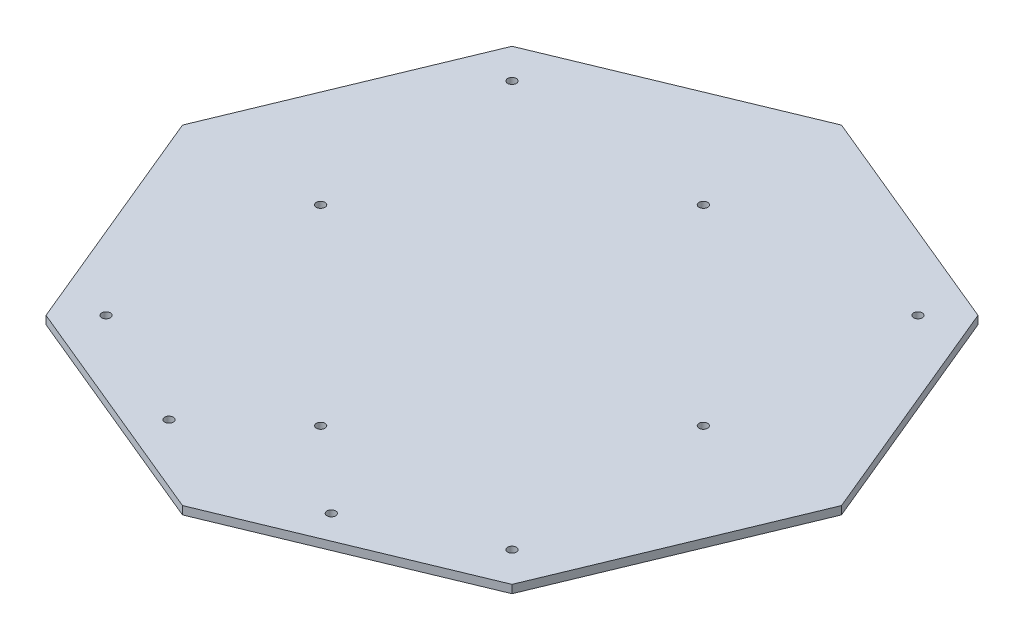
from build123d import *

# Parameters (mm, degrees)
BOSS_EXTRUDE2_DEPTH     = 3
CUT_EXTRUDE3_DEPTH      = 173.233673841
CUT_EXTRUDE3_DEPTH_BACK = 173.233673841
SKETCH3_R               = 1.6
CUT_EXTRUDE4_DEPTH      = 173.233673841
CUT_EXTRUDE4_DEPTH_BACK = 173.233673841
SKETCH4_R               = 1.6


with BuildPart() as part:
    # Sketch1 → Boss-Extrude2 (new body)
    with BuildSketch(Plane(origin=(0, 0, 0), x_dir=(1, 0, 0), z_dir=(0, 1, 0))):
        Polygon((0, -121.769122533), (86.103772282, -86.103772282), (121.769122533, 0), (86.103772282, 86.103772282), (0, 121.769122533), (-86.103772282, 86.103772282), (-121.769122533, 0), (-86.103772282, -86.103772282), align=None)
    extrude(amount=BOSS_EXTRUDE2_DEPTH)

    # Sketch3 → Cut-Extrude3 (cut, two sides: drawn at the far end of the back side and taken through both)
    with BuildSketch(Plane(origin=(0, 3, 0), x_dir=(1, 0, 0), z_dir=(0, 1, 0)).offset(-CUT_EXTRUDE3_DEPTH_BACK)):
        with Locations((-75, -75)):
            Circle(SKETCH3_R)
        with Locations((75, -75)):
            Circle(SKETCH3_R)
        with Locations((75, 75)):
            Circle(SKETCH3_R)
        with Locations((-75, 75)):
            Circle(SKETCH3_R)
        with Locations((-70.710678119, 0)):
            Circle(SKETCH3_R)
        with Locations((0, 70.710678119)):
            Circle(SKETCH3_R)
        with Locations((70.710678119, 0)):
            Circle(SKETCH3_R)
        with Locations((0, -70.710678119)):
            Circle(SKETCH3_R)
    extrude(amount=CUT_EXTRUDE3_DEPTH + CUT_EXTRUDE3_DEPTH_BACK, mode=Mode.SUBTRACT)

    # Sketch4 → Cut-Extrude4 (cut, two sides: drawn at the far end of the back side and taken through both)
    with BuildSketch(Plane(origin=(0, 3, 0), x_dir=(1, 0, 0), z_dir=(0, 1, 0)).offset(-CUT_EXTRUDE4_DEPTH_BACK)):
        with Locations((-30, -96.769122533)):
            Circle(SKETCH4_R)
        with Locations((30, -96.769122533)):
            Circle(SKETCH4_R)
    extrude(amount=CUT_EXTRUDE4_DEPTH + CUT_EXTRUDE4_DEPTH_BACK, mode=Mode.SUBTRACT)


solid = part.part
